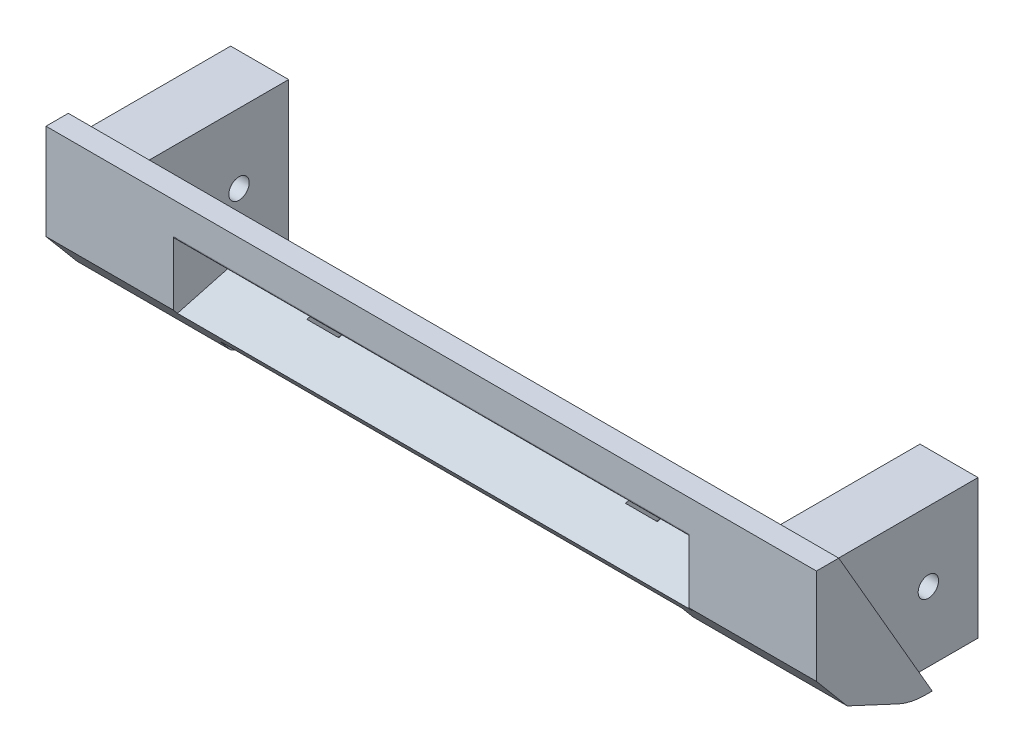
from build123d import *

# Parameters (mm, degrees)
BOSS_EXTRUDE2_DEPTH             = 120.9
BOSS_EXTRUDE1_REACH             = 138.078
SKETCH2_W                       = 18.2
SKETCH2_H                       = 43.65
BOSS_EXTRUDE1_DIRECTION_2_DEPTH = 18
M6_CLEARANCE_HOLE1_D            = 6.4
CUT_EXTRUDE6_DEPTH              = 137.078193862
CUT_EXTRUDE6_DEPTH_BACK         = 137.078193862
SKETCH13_W                      = 145
SKETCH13_H                      = 13.5
SKETCH13_W_2                    = 161.8
SKETCH13_H_2                    = 14
CHAMFER5_SIZE                   = 4.823085464
CHAMFER5_SIZE_2                 = 18
CHAMFER6_SIZE                   = 18
CHAMFER6_SIZE2                  = 4.823085464
CHAMFER7_SIZE                   = 7
CHAMFER7_SIZE_2                 = 10.646755418
CUT_EXTRUDE8_REACH              = 131.701
SKETCH15_W                      = 10
SKETCH15_H                      = 6
FILLET2_R                       = 20


with BuildPart() as part:
    # Sketch1 → Boss-Extrude2 (new, symmetric)
    with BuildSketch(Plane(origin=(0, 0, 0), x_dir=(0, 0, -1), z_dir=(1, 0, 0))):
        Polygon((0, 0), (-29.329393675, 50.8), (-36.329393675, 50.8), (-36.329393675, 13.8), (-6.735198172, 0), align=None)
    extrude(amount=BOSS_EXTRUDE2_DEPTH, both=True)

    # Boss-Extrude1: up to this plane
    boss_extrude1_end = Plane(origin=(120.9, 0, 0), z_dir=(0, -0.5000000000000043, 0.8660254037844363))
    # Sketch2 → Boss-Extrude1 (add, up to the surface)
    with BuildSketch(Plane.XY, mode=Mode.PRIVATE) as boss_extrude1_sk1:
        with Locations((108.175, 25.4)):
            Rectangle(SKETCH2_W, SKETCH2_H)
    boss_extrude1_tool1 = split(extrude(boss_extrude1_sk1.sketch, amount=BOSS_EXTRUDE1_REACH, mode=Mode.PRIVATE), bisect_by=boss_extrude1_end, keep=Keep.BOTH, mode=Mode.PRIVATE)
    add(boss_extrude1_tool1.solids().sort_by_distance((108.175, 25.4, 0))[0])
    # Sketch2 → Boss-Extrude1 (add, up to the surface)
    with BuildSketch(Plane.XY, mode=Mode.PRIVATE) as boss_extrude1_sk2:
        with Locations((-108.175, 25.4)):
            Rectangle(SKETCH2_W, SKETCH2_H)
    boss_extrude1_tool2 = split(extrude(boss_extrude1_sk2.sketch, amount=BOSS_EXTRUDE1_REACH, mode=Mode.PRIVATE), bisect_by=boss_extrude1_end, keep=Keep.BOTH, mode=Mode.PRIVATE)
    add(boss_extrude1_tool2.solids().sort_by_distance((-108.175, 25.4, 0))[0])

    # Sketch2 → Boss-Extrude1 direction 2 (add)
    with BuildSketch(Plane.XY):
        with Locations((108.175, 25.4)):
            Rectangle(SKETCH2_W, SKETCH2_H)
        with Locations((-108.175, 25.4)):
            Rectangle(SKETCH2_W, SKETCH2_H)
    extrude(amount=-BOSS_EXTRUDE1_DIRECTION_2_DEPTH)

    # M6 Clearance Hole1 (through all)
    with Locations(Plane(origin=(117.275, 0, 0), x_dir=(0, 0, -1), z_dir=(1, 0, 0))):
        with Locations((2.420606325, 25.4)):
            Hole(M6_CLEARANCE_HOLE1_D / 2)

    # Sketch13 → Cut-Extrude6 (cut, two sides: drawn at the far end of the back side and taken through both)
    with BuildSketch(Plane.XY.offset(-CUT_EXTRUDE6_DEPTH_BACK)):
        with Locations((0, 6.75)):
            Rectangle(SKETCH13_W, SKETCH13_H)
        with Locations((0, 30.8)):
            Rectangle(SKETCH13_W_2, SKETCH13_H_2)
    extrude(amount=CUT_EXTRUDE6_DEPTH + CUT_EXTRUDE6_DEPTH_BACK, mode=Mode.SUBTRACT)

    # Chamfer5
    # the kernel refuses this chamfer: 18, 4.823085464 mm, written as the material it takes off along each edge
    with BuildSketch(Plane(origin=(80.9, 37.8, 21.823840175), x_dir=(0, 0.9306108519370808, 0.366010166876469), z_dir=(-1, 0, 0))) as chamfer5_piece_1:
        Polygon((CHAMFER5_SIZE * 0.988937722204, -CHAMFER5_SIZE * 0.148331323403), (CHAMFER5_SIZE_2 * 0.366010166876, -CHAMFER5_SIZE_2 * 0.930610851937), (0, 0), align=None)
    extrude(amount=161.8, mode=Mode.SUBTRACT)

    # Chamfer6
    chamfer6_edges = [part.edges().sort_by_distance(p)[0] for p in [
        (0, 23.8, 36.329393675),
    ]]
    chamfer6_side = [part.faces().sort_by_distance(p)[0] for p in [
        (0, 23.8, 25.035165041),
    ]]
    chamfer(chamfer6_edges, length=CHAMFER6_SIZE, length2=CHAMFER6_SIZE2, reference=chamfer6_side[0])

    # Chamfer7
    # the kernel refuses this chamfer: 10.646755418, 7 mm, written as the material it takes off along each edge
    with BuildSketch(Plane(origin=(148.485482138, 13.8, 36.329393675), x_dir=(0, 0.9993026620124821, 0.037338849671180216), z_dir=(-1, 0, 0))) as chamfer7_piece_1:
        Polygon((CHAMFER7_SIZE * 0.999302662012, CHAMFER7_SIZE * 0.0373388496712), (-CHAMFER7_SIZE_2 * 0.456164044176, CHAMFER7_SIZE_2 * 0.88989570442), (0, 0), align=None)
    extrude(amount=296.970964275, mode=Mode.SUBTRACT)

    # Cut-Extrude8: up to this plane
    cut_extrude8_end = Plane(origin=(-80.9, 23.8, 18.329393675), z_dir=(0, -0.965925826289069, -0.25881904510251824))
    # Sketch15 → Cut-Extrude8 (cut, up to the surface)
    with BuildSketch(Plane(origin=(0, 13.5, 7.794228634), x_dir=(-1, 0, 0), z_dir=(0, 0.8660254037844363, 0.5000000000000042)), mode=Mode.PRIVATE) as cut_extrude8_sk1:
        with Locations((-50, 3)):
            Rectangle(SKETCH15_W, SKETCH15_H)
    cut_extrude8_tool1 = split(extrude(cut_extrude8_sk1.sketch, amount=CUT_EXTRUDE8_REACH, mode=Mode.PRIVATE), bisect_by=cut_extrude8_end, keep=Keep.BOTH, mode=Mode.PRIVATE)
    add(cut_extrude8_tool1.solids().sort_by_distance((50, 12, 10.392305))[0], mode=Mode.SUBTRACT)
    # Sketch15 → Cut-Extrude8 (cut, up to the surface)
    with BuildSketch(Plane(origin=(0, 13.5, 7.794228634), x_dir=(-1, 0, 0), z_dir=(0, 0.8660254037844363, 0.5000000000000042)), mode=Mode.PRIVATE) as cut_extrude8_sk2:
        with Locations((50, 3)):
            Rectangle(SKETCH15_W, SKETCH15_H)
    cut_extrude8_tool2 = split(extrude(cut_extrude8_sk2.sketch, amount=CUT_EXTRUDE8_REACH, mode=Mode.PRIVATE), bisect_by=cut_extrude8_end, keep=Keep.BOTH, mode=Mode.PRIVATE)
    add(cut_extrude8_tool2.solids().sort_by_distance((-50, 12, 10.392305))[0], mode=Mode.SUBTRACT)

    # Fillet1
    # an asymmetric fillet: 4, 1 mm, written as the material it takes off along each edge
    with BuildSketch(Plane(origin=(80.9, 38.736334118, 36.329393675), x_dir=(0, 1, 0), z_dir=(-1, 0, 0))) as fillet1_piece_1:
        with BuildLine():
            Bezier((2.10707295, 0), (0, 0), (1.141147124, 4.258819045), weights=[1, 0.608761429, 1])
            Line((1.141147124, 4.258819045), (0, 0))
            Line((0, 0), (2.10707295, 0))
        make_face()
    extrude(amount=161.8, mode=Mode.SUBTRACT)

    # Fillet2
    fillet2_edges = [part.edges().sort_by_distance(p)[0] for p in [
        (-96.7, 0, 6.735198172),
        (96.7, 0, 6.735198172),
    ]]
    fillet(fillet2_edges, radius=FILLET2_R)


solid = part.part
